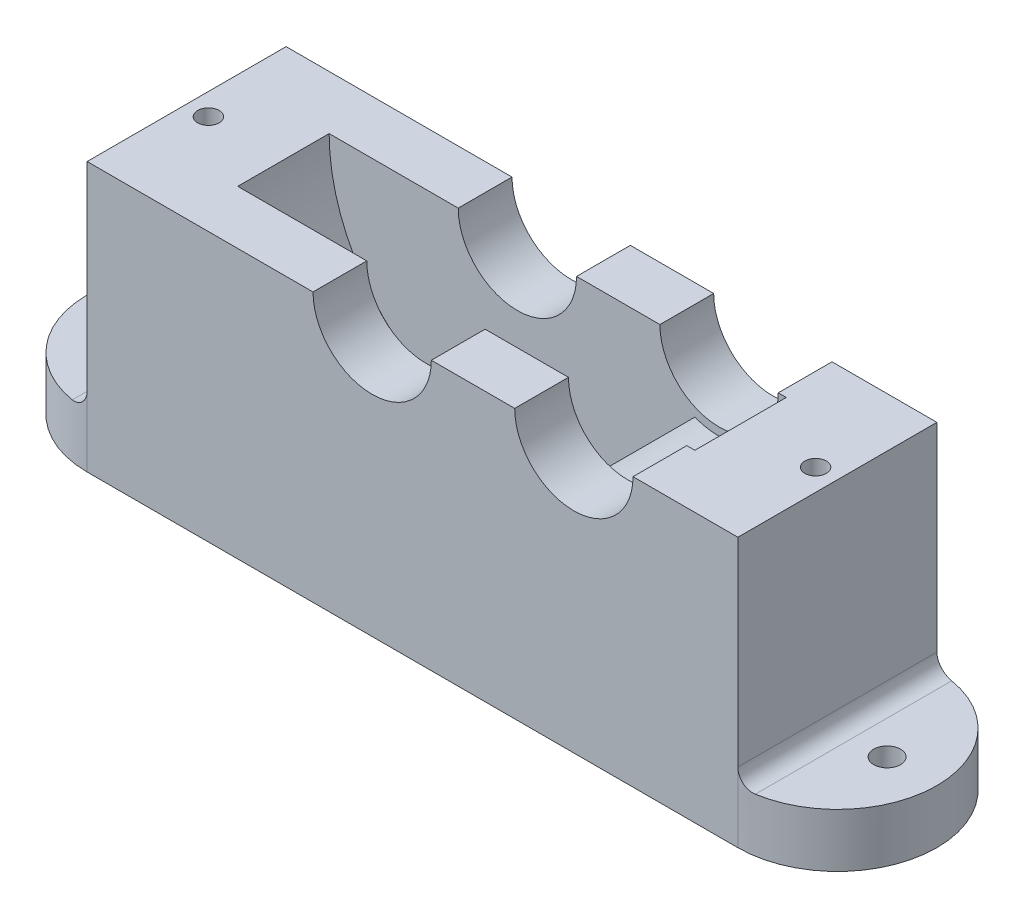
from build123d import *

# Parameters (mm, degrees)
BOSS_EXTRUDE2_DEPTH      = 27
SHELL5_DEPTH             = 17
BOSS_EXTRUDE3_START      = 10
BOSS_EXTRUDE3_DEPTH      = 10
SKETCH5_R                = 11
CUT_EXTRUDE2_DEPTH       = 87.360074687
BOSS_EXTRUDE4_DEPTH      = 37
BOSS_EXTRUDE5_DEPTH      = 3
BOSS_EXTRUDE5_DEPTH_BACK = 50
SKETCH10_R               = 2
CUT_EXTRUDE3_DEPTH       = 10
SKETCH11_W               = 121
SKETCH11_H               = 37
CUT_EXTRUDE4_DEPTH       = 92.526294036
BOSS_EXTRUDE6_DEPTH      = 10
FILLET1_R                = 3
SKETCH13_R               = 2.5
CUT_EXTRUDE5_DEPTH       = 103.342867477


# Read off the part's stored shape, not the designer's step: Shell5
with BuildPart() as part:
    # Sketch1 → Boss-Extrude2 (new body)
    with BuildSketch(Plane.XY):
        with BuildLine():
            ThreePointArc((20.25, 22.449944321), (-63.75, 0), (20.25, -22.449944321))
            ThreePointArc((20.25, -22.449944321), (41.25, 0), (20.25, 22.449944321))
        make_face()
    extrude(amount=BOSS_EXTRUDE2_DEPTH)

    # Shell5 outline → Shell5 (cut)
    with BuildSketch(Plane.XY):
        with BuildLine():
            ThreePointArc((14.25, -11.66190379), (31.25, 0), (14.25, 11.66190379))
            ThreePointArc((14.25, 11.66190379), (-53.75, 0), (14.25, -11.66190379))
        make_face()
    extrude(amount=SHELL5_DEPTH, mode=Mode.SUBTRACT)

    # Sketch4 → Boss-Extrude3 (add)
    with BuildSketch(Plane(origin=(0, 0, 0), x_dir=(-1, 0, 0), z_dir=(0, 0, -1)).offset(BOSS_EXTRUDE3_START)):
        with BuildLine():
            ThreePointArc((-20.25, 22.449944321), (-41.25, 0), (-20.25, -22.449944321))
            ThreePointArc((-20.25, -22.449944321), (63.75, 0), (-20.25, 22.449944321))
        make_face()
    extrude(amount=-BOSS_EXTRUDE3_DEPTH)

    # Sketch5 → Cut-Extrude2 (cut, through all)
    with BuildSketch(Plane(origin=(0, 0, -10), x_dir=(-1, 0, 0), z_dir=(0, 0, -1))):
        with Locations((-18.75, 0)):
            Circle(SKETCH5_R)
        with Locations((18.75, 0)):
            Circle(SKETCH5_R)
    extrude(amount=-CUT_EXTRUDE2_DEPTH, mode=Mode.SUBTRACT)

    # Sketch8 → Boss-Extrude4 (add)
    with BuildSketch(Plane(origin=(0, 0, -10), x_dir=(-1, 0, 0), z_dir=(0, 0, -1))):
        with BuildLine():
            Line((-41.25, 0), (-41.25, -50))
            Line((-41.25, -50), (63.75, -50))
            Line((63.75, -50), (63.75, 0))
            ThreePointArc((63.75, 0), (30.368950039, -43.474130239), (-20.25, -22.449944321))
            ThreePointArc((-20.25, -22.449944321), (-35.181676725, -15.370426149), (-41.25, 0))
        make_face()
    extrude(amount=-BOSS_EXTRUDE4_DEPTH)

    # Sketch9 → Boss-Extrude5 (add, two sides: drawn at the far end of the back side and taken through both)
    with BuildSketch(Plane(origin=(0, 0, 0), x_dir=(1, 0, 0), z_dir=(0, 1, 0)).offset(-BOSS_EXTRUDE5_DEPTH_BACK)):
        Polygon((-71.75, -27), (-58.75, -27), (-58.75, -8.5), (-58.75, 10), (-71.75, 10), align=None)
        Polygon((36.25, -8.5), (36.25, 10), (49.25, 10), (49.25, -27), (36.25, -27), align=None)
    extrude(amount=BOSS_EXTRUDE5_DEPTH + BOSS_EXTRUDE5_DEPTH_BACK)

    # Sketch10 → Cut-Extrude3 (cut)
    with BuildSketch(Plane(origin=(0, 3, 0), x_dir=(1, 0, 0), z_dir=(0, 1, 0))):
        with Locations(Location((-67.699944321, -8.5, 0), (0, 0, 270))):
            Circle(SKETCH10_R)
        with Locations(Location((45.199944321, -8.5, 0), (0, 0, 90))):
            Circle(SKETCH10_R)
    extrude(amount=-CUT_EXTRUDE3_DEPTH, mode=Mode.SUBTRACT)

    # Sketch11 → Cut-Extrude4 (cut, through all)
    with BuildSketch(Plane(origin=(0, 0, 0), x_dir=(1, 0, 0), z_dir=(0, 1, 0))):
        with Locations((-11.25, -8.5)):
            Rectangle(SKETCH11_W, SKETCH11_H)
    extrude(amount=CUT_EXTRUDE4_DEPTH, mode=Mode.SUBTRACT)

    # Sketch12 → Boss-Extrude6 (add)
    with BuildSketch(Plane.XZ.offset(50)):
        with BuildLine():
            Line((-71.75, 27), (49.25, 27))
            ThreePointArc((49.25, 27), (67.75, 8.5), (49.25, -10))
            Line((49.25, -10), (-71.75, -10))
            ThreePointArc((-71.75, -10), (-90.25, 8.5), (-71.75, 27))
        make_face()
    extrude(amount=-BOSS_EXTRUDE6_DEPTH)

    # Fillet1
    # the kernel refuses this fillet: 3 mm, written as the material it adds along each edge
    with BuildSketch(Plane(origin=(49.25, -40, -17.5), x_dir=(0, 1, 0), z_dir=(0, 0, 1))) as fillet1_piece_1_section:
        with BuildLine():
            CenterArc((FILLET1_R, -FILLET1_R), FILLET1_R, 90, 90)
            Line((0, -FILLET1_R), (0, 0))
            Line((0, 0), (FILLET1_R, 0))
        make_face()
    fillet1_piece_1 = extrude(amount=52, mode=Mode.PRIVATE)
    fillet1_piece_1 = fillet1_piece_1 & Plane(origin=(49.25, -39.329436552, 8.5), x_dir=(0, 0, 1), z_dir=(0, -1, 0)) * Cylinder(18.5, 116, mode=Mode.PRIVATE)
    add(fillet1_piece_1)
    with BuildSketch(Plane(origin=(-71.75, -40, -17.5), x_dir=(0, 1, 0), z_dir=(0, 0, 1))) as fillet1_piece_2_section:
        with BuildLine():
            CenterArc((FILLET1_R, FILLET1_R), FILLET1_R, 180, 90)
            Line((0, FILLET1_R), (0, 0))
            Line((0, 0), (FILLET1_R, 0))
        make_face()
    fillet1_piece_2 = extrude(amount=52, mode=Mode.PRIVATE)
    fillet1_piece_2 = fillet1_piece_2 & Plane(origin=(-71.75, -39.329436515, 8.5), x_dir=(0, 0, -1), z_dir=(0, -1, 0)) * Cylinder(18.5, 116, mode=Mode.PRIVATE)
    add(fillet1_piece_2)

    # Sketch13 → Cut-Extrude5 (cut, through all)
    with BuildSketch(Plane(origin=(0, -40, 0), x_dir=(1, 0, 0), z_dir=(0, 1, 0))):
        with Locations(Location((-81, -8.5, 0), (0, 0, 270))):
            Circle(SKETCH13_R)
        with Locations(Location((58.5, -8.5, 0), (0, 0, 270))):
            Circle(SKETCH13_R)
    extrude(amount=-CUT_EXTRUDE5_DEPTH, mode=Mode.SUBTRACT)


solid = part.part
